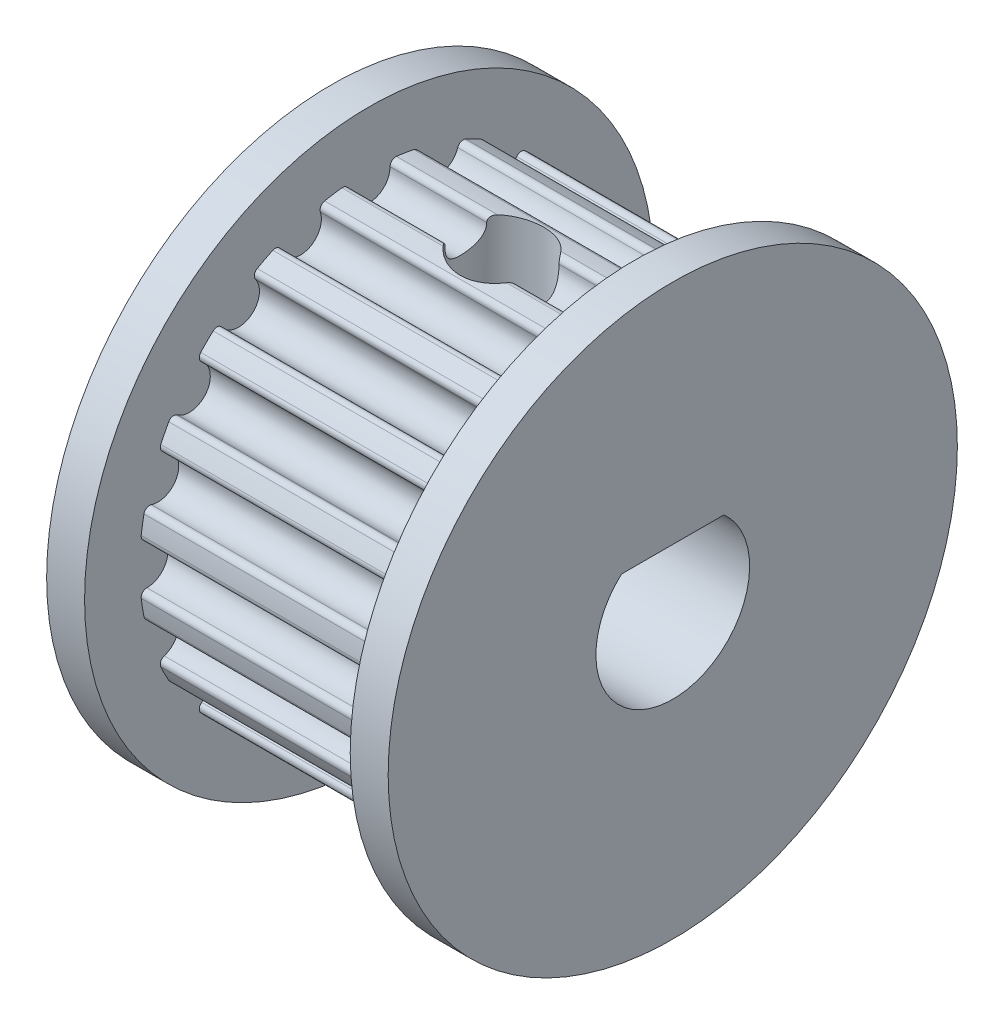
from build123d import *

# Parameters (mm, degrees)
SKETCH_3_R         = 0.55
F_20TOOTH_DEPTH    = 7
FILLET_1_R         = 0.15
CUT_EXTRUDE1_DEPTH = 14.910427851
SKETCH2_W          = 1.1
SKETCH2_H          = 5.990654115


with BuildPart() as part:
    # Эскиз1 → Body (revolve)
    with BuildSketch(Plane.XY):
        Polygon((1, 7.5), (0, 7.5), (0, 0), (9, 0), (9, 7.5), (8, 7.5), (8, 6.05), (1, 6.05), align=None)
    revolve(axis=Axis((0, 0, 0), (1, 0, 0)))

    # Эскиз3 → 20tooth (cut)
    with BuildSketch(Plane(origin=(1, 0, 0), x_dir=(0, 0, -1), z_dir=(1, 0, 0))):
        with Locations((5.568435903, -1.809294502)):
            Circle(SKETCH_3_R)
        with Locations((4.736794502, -3.441482652)):
            Circle(SKETCH_3_R)
        with Locations((3.441482652, -4.736794502)):
            Circle(SKETCH_3_R)
        with Locations((1.809294502, -5.568435903)):
            Circle(SKETCH_3_R)
        with Locations((0, -5.855)):
            Circle(SKETCH_3_R)
        with Locations((5.855, 0)):
            Circle(SKETCH_3_R)
        with Locations((-1.809294502, -5.568435903)):
            Circle(SKETCH_3_R)
        with Locations((-3.441482652, -4.736794502)):
            Circle(SKETCH_3_R)
        with Locations((-4.736794502, -3.441482652)):
            Circle(SKETCH_3_R)
        with Locations((-5.568435903, -1.809294502)):
            Circle(SKETCH_3_R)
        with Locations((-5.855, 0)):
            Circle(SKETCH_3_R)
        with Locations((-5.568435903, 1.809294502)):
            Circle(SKETCH_3_R)
        with Locations((-4.736794502, 3.441482652)):
            Circle(SKETCH_3_R)
        with Locations((-3.441482652, 4.736794502)):
            Circle(SKETCH_3_R)
        with Locations((-1.809294502, 5.568435903)):
            Circle(SKETCH_3_R)
        with Locations((0, 5.855)):
            Circle(SKETCH_3_R)
        with Locations((1.809294502, 5.568435903)):
            Circle(SKETCH_3_R)
        with Locations((3.441482652, 4.736794502)):
            Circle(SKETCH_3_R)
        with Locations((4.736794502, 3.441482652)):
            Circle(SKETCH_3_R)
        with Locations((5.568435903, 1.809294502)):
            Circle(SKETCH_3_R)
    extrude(amount=F_20TOOTH_DEPTH, mode=Mode.SUBTRACT)

    # Скругление1
    fillet_1_edges = [part.edges().sort_by_distance(p)[0] for p in [
        (4.5, -0.522276943, -6.027414603),
        (4.5, 0.522276943, -6.027414603),
        (4.5, -1.365858655, -5.893804386),
        (4.5, -2.359288434, -5.571019483),
        (4.5, -3.120294491, -5.18326753),
        (4.5, -3.965356335, -4.569294161),
        (4.5, -4.569294161, -3.965356335),
        (4.5, -5.18326753, -3.120294491),
        (4.5, -5.571019483, -2.359288434),
        (4.5, -5.893804386, -1.365858655),
        (4.5, -6.027414603, -0.522276943),
        (4.5, -6.027414603, 0.522276943),
        (4.5, -5.893804386, 1.365858655),
        (4.5, -5.571019483, 2.359288434),
        (4.5, -5.18326753, 3.120294491),
        (4.5, -4.569294161, 3.965356335),
        (4.5, -3.965356335, 4.569294161),
        (4.5, -3.120294491, 5.18326753),
        (4.5, -2.359288434, 5.571019483),
        (4.5, -1.365858655, 5.893804386),
        (4.5, -0.522276943, 6.027414603),
        (4.5, 0.522276943, 6.027414603),
        (4.5, 1.365858655, 5.893804386),
        (4.5, 2.359288434, 5.571019483),
        (4.5, 3.120294491, 5.18326753),
        (4.5, 3.965356335, 4.569294161),
        (4.5, 4.569294161, 3.965356335),
        (4.5, 5.18326753, 3.120294491),
        (4.5, 5.571019483, 2.359288434),
        (4.5, 5.893804386, 1.365858655),
        (4.5, 6.027414603, -0.522276943),
        (4.5, 5.571019483, -2.359288434),
        (4.5, 4.569294161, -3.965356335),
        (4.5, 3.120294491, -5.18326753),
        (4.5, 1.365858655, -5.893804386),
        (4.5, 2.359288434, -5.571019483),
        (4.5, 3.965356335, -4.569294161),
        (4.5, 6.027414603, 0.522276943),
        (4.5, 5.893804386, -1.365858655),
        (4.5, 5.18326753, -3.120294491),
    ]]
    fillet(fillet_1_edges, radius=FILLET_1_R)

    # Sketch1 → Cut-Extrude1 (cut, through all)
    with BuildSketch(Plane(origin=(9, 0, 0), x_dir=(0, 0, -1), z_dir=(1, 0, 0))):
        with BuildLine():
            Line((-1.35, 1.509345885), (1.35, 1.509345885))
            ThreePointArc((1.35, 1.509345885), (0, -2.025), (-1.35, 1.509345885))
        make_face()
    extrude(amount=-CUT_EXTRUDE1_DEPTH, mode=Mode.SUBTRACT)

    # Sketch2 → M2 Clearance Hole1 (revolve, cut)
    with BuildSketch(Plane(origin=(4.5, 1.509345885, 0), x_dir=(0, 0, -1), z_dir=(1, 0, 0))):
        with Locations((0.55, 2.995327058)):
            Rectangle(SKETCH2_W, SKETCH2_H)
    revolve(axis=Axis((4.5, -4.840654115, 0), (0, 1, 0)), mode=Mode.SUBTRACT)


solid = part.part
